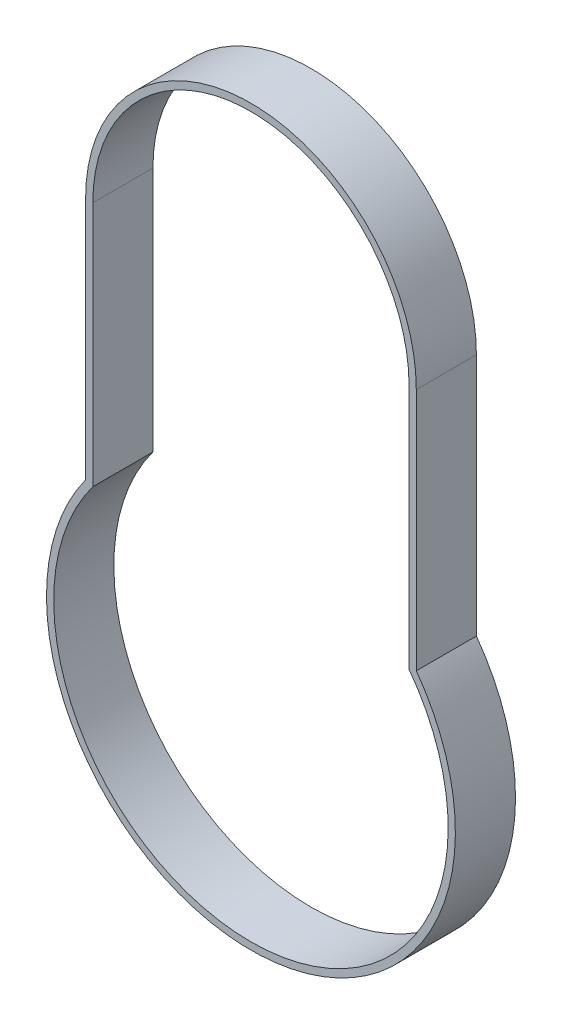
from build123d import *

# Parameters (mm, degrees)
EXTRU_MINCE1_DEPTH = 10


with BuildPart() as part:
    # Esquisse1 → Extru.-Mince1 (new body)
    with BuildSketch(Plane.XY):
        with BuildLine():
            Line((-27.5, -40.506250977), (-27.5, 0))
            ThreePointArc((-27.5, 0), (0, 27.5), (27.5, 0))
            Line((27.5, 0), (27.5, -40.506250977))
            ThreePointArc((27.5, -40.506250977), (0, -94.5), (-27.5, -40.506250977))
        make_face()
        with BuildLine():
            Line((-26.3, -40.900255104), (-26.3, 0))
            ThreePointArc((-26.3, 0), (0, 26.3), (26.3, 0))
            Line((26.3, 0), (26.3, -40.900255104))
            ThreePointArc((26.3, -40.900255104), (0, -93.3), (-26.3, -40.900255104))
        make_face(mode=Mode.SUBTRACT)
    extrude(amount=EXTRU_MINCE1_DEPTH)


solid = part.part
